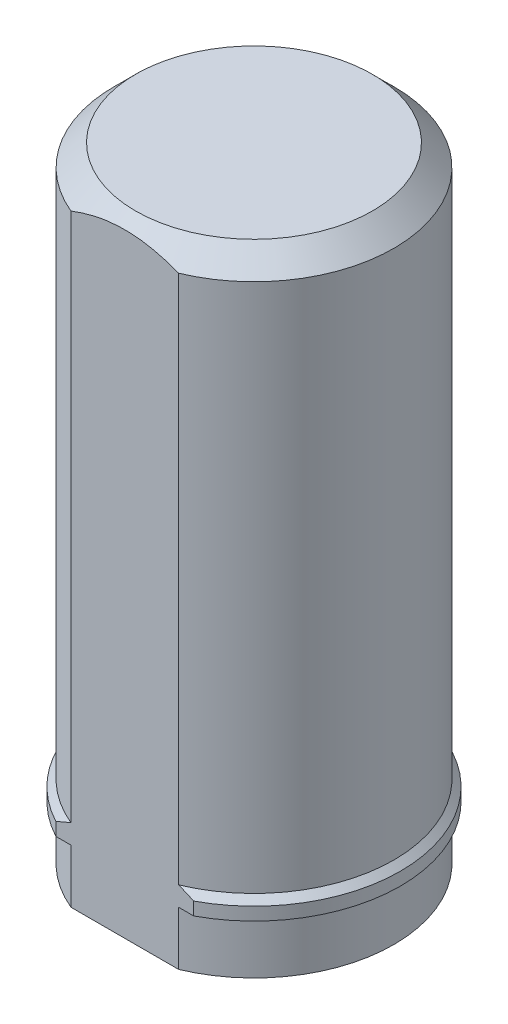
from build123d import *

# Parameters (mm, degrees)
BOSS_EXTRUDE1_DEPTH = 7.25
BOSS_EXTRUDE2_START = -1.75
BOSS_EXTRUDE2_DEPTH = 0.5
CHAMFER1_SIZE       = 0.2


with BuildPart() as part:
    # Sketch1 → Boss-Extrude1 (new, symmetric)
    with BuildSketch(Plane(origin=(0, 0, 0), x_dir=(1, 0, 0), z_dir=(0, 1, 0))):
        with BuildLine():
            Line((-1.25, -3), (1.25, -3))
            ThreePointArc((1.25, -3), (0, 3.25), (-1.25, -3))
        make_face()
    extrude(amount=BOSS_EXTRUDE1_DEPTH, both=True)

    # Sketch2 → Boss-Extrude2 (add)
    with BuildSketch(Plane.XZ.offset(7.25).offset(BOSS_EXTRUDE2_START)):
        with BuildLine():
            Line((-1.25, 3), (-1.6, 3))
            ThreePointArc((-1.6, 3), (0, -3.4), (1.6, 3))
            Line((1.6, 3), (1.25, 3))
            ThreePointArc((1.25, 3), (0, -3.25), (-1.25, 3))
        make_face()
    extrude(amount=BOSS_EXTRUDE2_DEPTH)

    # Chamfer1
    # the kernel refuses this chamfer: 0.2 mm, written as the material it takes off along each edge
    with BuildSketch(Plane(origin=(0, -5.5, 0), x_dir=(-0.3315887986155938, 0, 0.9434240131736458), z_dir=(0.9434240131736458, 0, 0.3315887986155938))) as chamfer1_piece_1_section:
        Polygon((3.4, CHAMFER1_SIZE), (3.4 - CHAMFER1_SIZE, 0), (3.4, 0), align=None)
    chamfer1_piece_1 = revolve(axis=Axis((0, -5.5, 0), (0, -1, 0)), revolution_arc=321.269525005, mode=Mode.PRIVATE)
    chamfer1_piece_1 = chamfer1_piece_1 - Plane(origin=(0, -5.5, 0), x_dir=(0.38461538461538497, 0, 0.923076923076923), z_dir=(0, 1, 0)) * Cylinder(3.25, 14, mode=Mode.PRIVATE)
    add(chamfer1_piece_1, mode=Mode.SUBTRACT)

    # Chamfer2: read off the stored shape, not the designer's step
    # Chamfer2 outline → Chamfer2 (revolve, cut)
    with BuildSketch(Plane.XY):
        Polygon((3.25, 7.25), (2.75, 7.25), (3.25, 6.75), align=None)
    revolve(axis=Axis((0, 0, 0), (0, 1, 0)), mode=Mode.SUBTRACT)


solid = part.part
